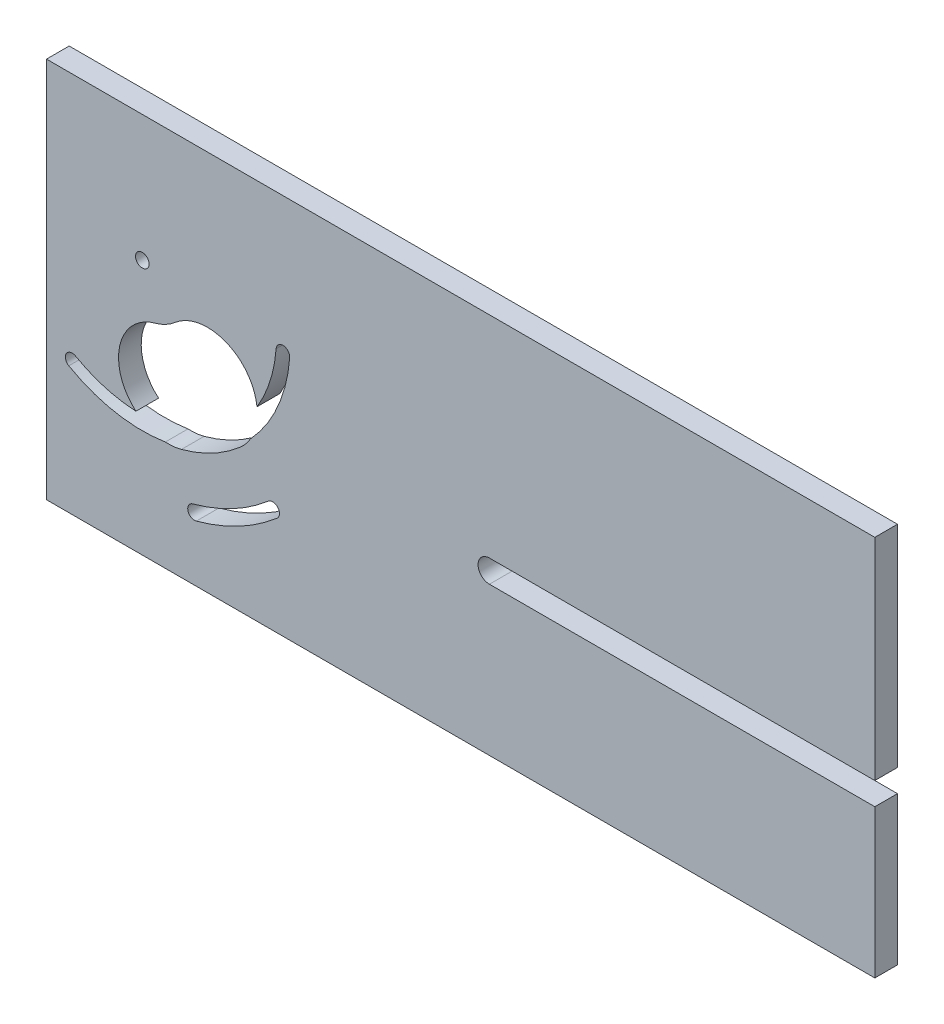
from build123d import *

# Parameters (mm, degrees)
SKETCH1_R           = 1.5
BOSS_EXTRUDE1_DEPTH = 5


with BuildPart() as part:
    # Sketch1 → Boss-Extrude1 (new body)
    with BuildSketch(Plane.XY):
        with BuildLine():
            Line((-91.35, 42.09), (-91.35, -42.09))
            Line((-91.35, -42.09), (91.35, -42.09))
            Line((91.35, -42.09), (91.35, -9.373756295))
            Line((91.35, -9.373756295), (6.343053199, -9.373756295))
            ThreePointArc((6.343053199, -9.373756295), (3.843053199, -6.873756295), (6.343053199, -4.373756295))
            Line((6.343053199, -4.373756295), (91.35, -4.373756295))
            Line((91.35, -4.373756295), (91.35, 42.09))
            Line((91.35, 42.09), (-91.35, 42.09))
        make_face()
        with BuildLine():
            ThreePointArc((-40.489979298, -20.16630551), (-48.867123378, -25.905481248), (-58.308825968, -29.642984865))
            ThreePointArc((-58.308825968, -29.642984865), (-60.149390448, -28.588317906), (-59.094723489, -26.747753426))
            ThreePointArc((-59.094723489, -26.747753426), (-50.275796541, -23.25677592), (-42.451209718, -17.896156784))
            ThreePointArc((-42.451209718, -17.896156784), (-40.846464239, -17.667243828), (-39.970594508, -19.031231147))
            ThreePointArc((-39.970594508, -19.031231147), (-40.106607189, -19.655361416), (-40.489979298, -20.16630551))
        make_face(mode=Mode.SUBTRACT)
        with BuildLine():
            ThreePointArc((-65.144358521, -17.951194504), (-76.122435192, -17.811173415), (-86.43146485, -14.034709351))
            ThreePointArc((-86.43146485, -14.034709351), (-86.987178316, -11.987471568), (-84.939940533, -11.431758101))
            ThreePointArc((-84.939940533, -11.431758101), (-78.516125038, -14.163976019), (-71.631092615, -15.315821832))
            ThreePointArc((-71.631092615, -15.315821832), (-75.191833702, -4.546421602), (-67.344295246, 3.643511155))
            ThreePointArc((-67.344295246, 3.643511155), (-65.062648548, 4.546702365), (-63.038259097, 5.933610208))
            ThreePointArc((-63.038259097, 5.933610208), (-51.860585441, 7.861943698), (-44.921737847, -1.110862578))
            ThreePointArc((-44.921737847, -1.110862578), (-42.027839791, 5.241756905), (-40.702136642, 12.095437041))
            ThreePointArc((-40.702136642, 12.095437041), (-39.151472366, 13.485222207), (-37.706118198, 11.986217927))
            ThreePointArc((-37.706118198, 11.986217927), (-37.707113918, 11.931572095), (-37.710099754, 11.876998812))
            ThreePointArc((-37.710099754, 11.876998812), (-40.341925186, 1.21814014), (-46.362913364, -7.96257196))
            ThreePointArc((-46.362913364, -7.96257196), (-47.396661948, -9.432315012), (-48.655902683, -10.714147119))
            ThreePointArc((-48.655902683, -10.714147119), (-54.732378683, -14.877136713), (-61.581046755, -17.588186064))
            ThreePointArc((-61.581046755, -17.588186064), (-63.34782833, -17.915697351), (-65.144358521, -17.951194504))
        make_face(mode=Mode.SUBTRACT)
        with Locations((-70.223567272, 14.250694236)):
            Circle(SKETCH1_R, mode=Mode.SUBTRACT)
    extrude(amount=BOSS_EXTRUDE1_DEPTH)


solid = part.part
